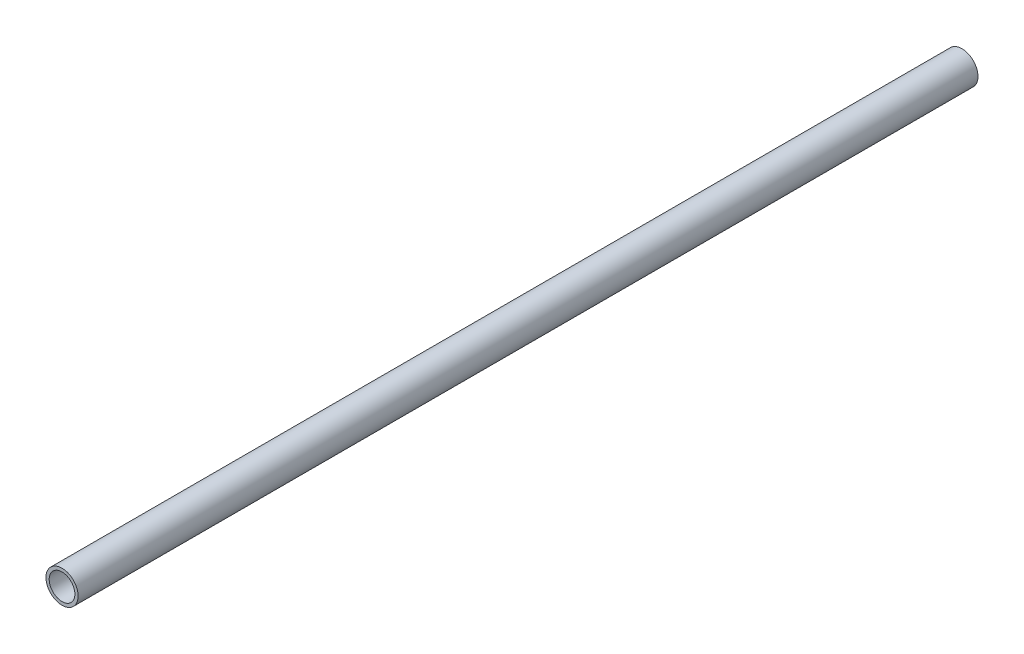
from build123d import *

# Parameters (mm, degrees)
SKETCH1_R           = 7.5
SKETCH1_R_2         = 6
BOSS_EXTRUDE1_DEPTH = 420


with BuildPart() as part:
    # Sketch1 → Boss-Extrude1 (new body)
    with BuildSketch(Plane.XY):
        with Locations((390.7614039, 31.081528881)):
            Circle(SKETCH1_R)
        with Locations((390.7614039, 31.081528881)):
            Circle(SKETCH1_R_2, mode=Mode.SUBTRACT)
    extrude(amount=BOSS_EXTRUDE1_DEPTH)


solid = part.part
